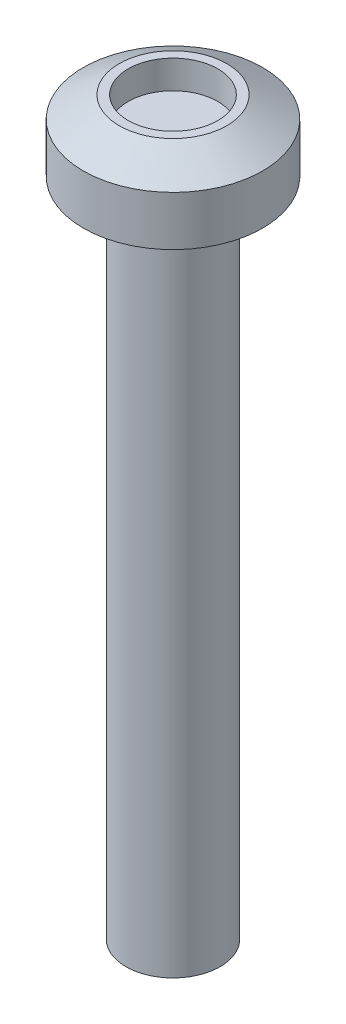
from build123d import *

# Parameters (mm, degrees)
SKETCH2_R          = 0.95
CUT_EXTRUDE1_DEPTH = 0.6


with BuildPart() as part:
    # Sketch1 → Revolve1 (revolve)
    with BuildSketch(Plane.XY):
        Polygon((0, -14), (1, -14), (1, 0), (1.9, 0), (1.9, 1.05), (1.14, 1.5), (0, 1.5), align=None)
    revolve(axis=Axis((0, -10, 0), (0, 1, 0)))

    # Sketch2 → Cut-Extrude1 (cut)
    with BuildSketch(Plane(origin=(0, 1.5, 0), x_dir=(1, 0, 0), z_dir=(0, 1, 0))):
        Circle(SKETCH2_R)
    extrude(amount=-CUT_EXTRUDE1_DEPTH, mode=Mode.SUBTRACT)


solid = part.part
